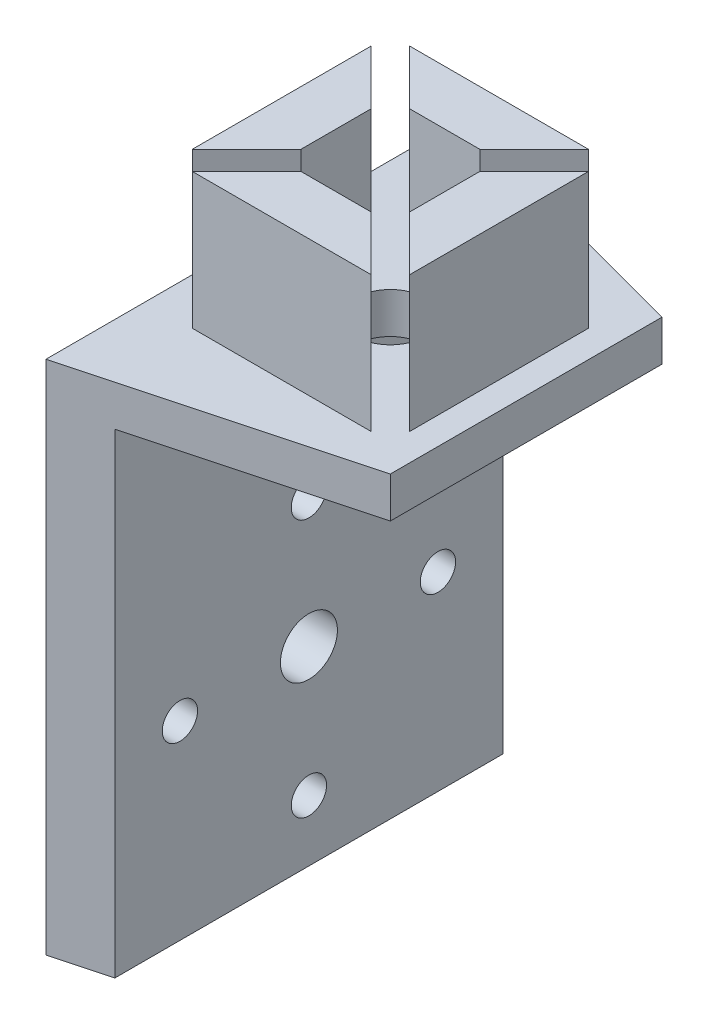
from build123d import *

# Parameters (mm, degrees)
BOSS_EXTRUDE1_DEPTH   = 10
BOSS_EXTRUDE1_2_DEPTH = 10
BOSS_EXTRUDE1_3_DEPTH = 10
BOSS_EXTRUDE1_4_DEPTH = 10
SKETCH1_3_W           = 20
SKETCH1_3_H           = 20
SKETCH1_3_R           = 2.5
BOSS_EXTRUDE2_DEPTH   = 3
SKETCH3_W             = 4
SKETCH3_H             = 20
BOSS_EXTRUDE3_DEPTH   = 35
BOSS_EXTRUDE4_START   = -188
BOSS_EXTRUDE4_DEPTH   = 38
BOSS_EXTRUDE4_START_2 = -153
BOSS_EXTRUDE4_2_DEPTH = 3
BOSS_EXTRUDE8_START   = -188
BOSS_EXTRUDE8_DEPTH   = 38
BOSS_EXTRUDE8_START_2 = -153
BOSS_EXTRUDE8_2_DEPTH = 3
SKETCH4_R             = 1.3
CUT_EXTRUDE1_DEPTH    = 4
SKETCH5_R             = 2.1
CUT_EXTRUDE2_DEPTH    = 200.679234698


# Read off the part's stored shape, not the designer's step: Boss-Extrude4, Boss-Extrude8
with BuildPart() as part:
    # Sketch1 → Boss-Extrude1 (new body)
    with BuildSketch(Plane.XZ.offset(150)):
        Polygon((111.9, 58), (108.414213562, 58), (112.414213562, 54), (117.585786438, 54), (121.585786438, 58), (118.1, 58), align=None)
    extrude(amount=-BOSS_EXTRUDE1_DEPTH)



with BuildPart() as body_2:
    # Sketch1 → Boss-Extrude1 2 (new body)
    with BuildSketch(Plane.XZ.offset(150)):
        Polygon((111, 47.414213562), (111, 52.585786438), (107, 56.585786438), (107, 53.1), (107, 46.9), (107, 43.414213562), align=None)
    extrude(amount=-BOSS_EXTRUDE1_2_DEPTH)


with BuildPart() as body_3:
    # Sketch1 → Boss-Extrude1 3 (new body)
    with BuildSketch(Plane.XZ.offset(150)):
        Polygon((123, 53.1), (123, 56.585786438), (119, 52.585786438), (119, 47.414213562), (123, 43.414213562), (123, 46.9), align=None)
    extrude(amount=-BOSS_EXTRUDE1_3_DEPTH)


with BuildPart() as body_4:
    # Sketch1 → Boss-Extrude1 4 (new body)
    with BuildSketch(Plane.XZ.offset(150)):
        Polygon((112.414213562, 46), (108.414213562, 42), (111.9, 42), (118.1, 42), (121.585786438, 42), (117.585786438, 46), align=None)
    extrude(amount=-BOSS_EXTRUDE1_4_DEPTH)


with BuildPart() as part_1:
    add(part.part)

    add(body_2.part)  # Boss-Extrude2 merges body 2

    add(body_3.part)  # Boss-Extrude2 merges body 3

    add(body_4.part)  # Boss-Extrude2 merges body 4
    # Sketch1<3> → Boss-Extrude2 (add)
    with BuildSketch(Plane.XZ.offset(150)):
        with Locations((115, 50)):
            Rectangle(SKETCH1_3_W, SKETCH1_3_H)
        with Locations(Location((115, 50, 0), (0, 0, 270))):
            Circle(SKETCH1_3_R, mode=Mode.SUBTRACT)
    extrude(amount=BOSS_EXTRUDE2_DEPTH)

    # Sketch3 → Boss-Extrude3 (add)
    with BuildSketch(Plane.XZ.offset(153)):
        with Locations((107, 50)):
            Rectangle(SKETCH3_W, SKETCH3_H)
    extrude(amount=BOSS_EXTRUDE3_DEPTH)

    # Boss-Extrude4 outline → Boss-Extrude4 (add)
    with BuildSketch(Plane(origin=(0, 0, 0), x_dir=(1, 0, 0), z_dir=(0, 1, 0)).offset(BOSS_EXTRUDE4_START)):
        Polygon((105, -34.641016151), (105, -40), (109, -40), (109, -35.712812921), align=None)
    extrude(amount=BOSS_EXTRUDE4_DEPTH)

    # Boss-Extrude4 2 outline → Boss-Extrude4 2 (add)
    with BuildSketch(Plane(origin=(0, 0, 0), x_dir=(1, 0, 0), z_dir=(0, 1, 0)).offset(BOSS_EXTRUDE4_START_2)):
        Polygon((109, -35.712812921), (109, -40), (125, -40), align=None)
    extrude(amount=BOSS_EXTRUDE4_2_DEPTH)

    # Boss-Extrude8 outline → Boss-Extrude8 (add)
    with BuildSketch(Plane(origin=(0, 0, 0), x_dir=(1, 0, 0), z_dir=(0, 1, 0)).offset(BOSS_EXTRUDE8_START)):
        Polygon((105, -60), (105, -65.358983849), (109, -64.287187079), (109, -60), align=None)
    extrude(amount=BOSS_EXTRUDE8_DEPTH)

    # Boss-Extrude8 2 outline → Boss-Extrude8 2 (add)
    with BuildSketch(Plane(origin=(0, 0, 0), x_dir=(1, 0, 0), z_dir=(0, 1, 0)).offset(BOSS_EXTRUDE8_START_2)):
        Polygon((109, -60), (109, -64.287187079), (125, -60), align=None)
    extrude(amount=BOSS_EXTRUDE8_2_DEPTH)

    # Sketch4 → Cut-Extrude1 (cut)
    with BuildSketch(Plane(origin=(105, 0, -65), x_dir=(0, 0, -1), z_dir=(1, 0, 0))):
        with Locations(Location((-115, -164.5, 0), (0, 0, 180))):
            Circle(SKETCH4_R)
        with Locations(Location((-105.5, -174, 0), (0, 0, 180))):
            Circle(SKETCH4_R)
        with Locations(Location((-115, -183.5, 0), (0, 0, 180))):
            Circle(SKETCH4_R)
        with Locations(Location((-124.5, -174, 0), (0, 0, 180))):
            Circle(SKETCH4_R)
    extrude(amount=CUT_EXTRUDE1_DEPTH, mode=Mode.SUBTRACT)

    # Sketch5 → Cut-Extrude2 (cut, through all)
    with BuildSketch(Plane(origin=(109, 0, 0), x_dir=(0, 0, -1), z_dir=(1, 0, 0))):
        with Locations((-50, -174)):
            Circle(SKETCH5_R)
    extrude(amount=-CUT_EXTRUDE2_DEPTH, mode=Mode.SUBTRACT)


solid = part_1.part
